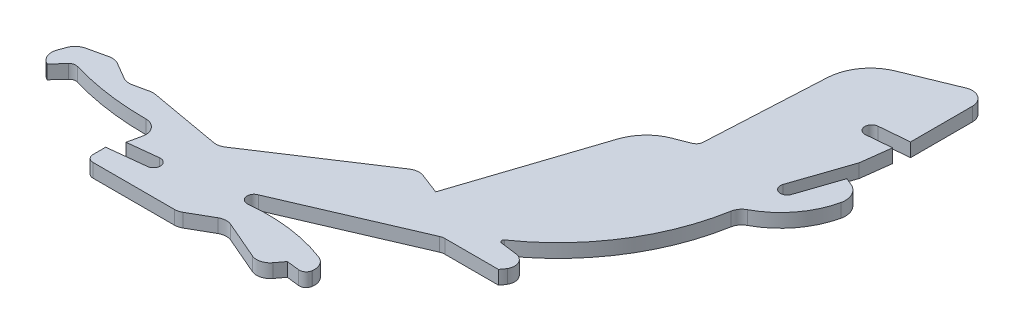
from build123d import *

# Parameters (mm, degrees)
BOSS_EXTRUDE1_DEPTH = 3
FILLET1_R           = 3
FILLET2_R           = 1.5
FILLET3_R           = 10
FILLET4_R           = 3
FILLET5_R           = 4
FILLET6_R           = 2.5
FILLET7_R           = 0.5


with BuildPart() as part:
    # Sketch3 → Boss-Extrude1 (new body)
    with BuildSketch(Plane(origin=(0, 0, 0), x_dir=(1, 0, 0), z_dir=(0, 1, 0))):
        with BuildLine():
            Line((7.923093171, 8.181542538), (1.28839884, 7.442154357))
            Line((1.28839884, 7.442154357), (2.76822933, 14.19))
            ThreePointArc((2.76822933, 14.19), (-8.413807268, 14.494015924), (-19.359710867, 16.8))
            Line((-19.359710867, 16.8), (-22.216794933, 13.666296862))
            Line((-22.216794933, 13.666296862), (-24.820279869, 14.62298821))
            Line((-24.820279869, 14.62298821), (-22.646481841, 20.53863742))
            Line((-22.646481841, 20.53863742), (-15.703804617, 22.111794774))
            Line((-15.703804617, 22.111794774), (-10.073302156, 18.818482014))
            Line((-10.073302156, 18.818482014), (-5.186450964, 19.880840969))
            Line((-5.186450964, 19.880840969), (12.13, 16.8))
            Line((12.13, 16.8), (38.76, 34.29))
            Line((38.76, 34.29), (44.7, 32))
            Line((44.7, 32), (56.058554748, 66.4069852))
            Line((56.058554748, 66.4069852), (64.552315124, 69.756868371))
            Line((64.552315124, 69.756868371), (66.29, 103.00790875))
            Line((66.29, 103.00790875), (87.31, 111.63))
            Line((87.31, 111.63), (87.31, 93.591357519))
            Line((87.31, 93.591357519), (80.722672152, 93.01504101))
            ThreePointArc((80.722672152, 93.01504101), (79.359113719, 91.390015348), (80.984139381, 90.026456915))
            Line((80.984139381, 90.026456915), (86.46321022, 90.505813501))
            Line((86.46321022, 90.505813501), (85.632866314, 84))
            Line((85.632866314, 84), (81.389705108, 71.508585308))
            ThreePointArc((81.389705108, 71.508585308), (82.327545423, 69.605835839), (84.230294892, 70.543676154))
            Line((84.230294892, 70.543676154), (87.31, 79.61))
            Line((87.31, 79.61), (91.618486592, 77.887634392))
            ThreePointArc((91.618486592, 77.887634392), (88.600013238, 68.48894743), (80.984139381, 62.208424889))
            ThreePointArc((80.984139381, 62.208424889), (74.158506271, 43.709858628), (60.297831214, 29.686025056))
            Line((60.297831214, 29.686025056), (68.03871852, 28.66301442))
            ThreePointArc((68.03871852, 28.66301442), (67.586257486, 26.243028794), (66.29, 24.15))
            Line((66.29, 24.15), (54.05, 24.15))
            Line((54.05, 24.15), (25.830040494, 11.99))
            ThreePointArc((25.830040494, 11.99), (24.800734775, 10.253880031), (26.431506195, 9.064692331))
            ThreePointArc((26.431506195, 9.064692331), (36.664028635, 8.803570476), (46.46571567, 5.854056721))
            Line((46.46571567, 5.854056721), (45.9, 1.991540554))
            Line((45.9, 1.991540554), (41.660045255, 2.482673431))
            Line((41.660045255, 2.482673431), (38.9, -1.2))
            Line((38.9, -1.2), (27.015518097, 3.924692331))
            Line((27.015518097, 3.924692331), (20.16, 0))
            Line((20.16, 0), (0, 0))
            Line((0, 0), (0, 4.28))
            Line((0, 4.28), (8.255364291, 5.2))
            ThreePointArc((8.255364291, 5.2), (9.58, 6.856906829), (7.923093171, 8.181542538))
        make_face()
    extrude(amount=BOSS_EXTRUDE1_DEPTH)

    # Fillet1
    # the kernel refuses this fillet: 3 mm, written as the material it adds along each edge
    with BuildSketch(Plane(origin=(80.984139381, 0, -62.208424889), x_dir=(0.9022478681487618, 0, -0.4312177923289046), z_dir=(0, 1, 0))) as fillet1_piece_1:
        with BuildLine():
            CenterArc((1.578679862, -2.997421373), FILLET1_R, 92.37575888, 52.157589609)
            ThreePointArc((-0.864680258, -1.256734347), (-0.427200708, -0.631903288), (0, 0))
            ThreePointArc((0, 0), (0.72716053, -0.015077949), (1.45432106, 0))
        make_face()
    extrude(amount=3)
    with BuildSketch(Plane(origin=(27.015518097, 0, -3.924692331), x_dir=(0.9182659150547935, 0, 0.39596427774305953), z_dir=(0, 1, 0))) as fillet1_piece_2:
        with BuildLine():
            CenterArc((FILLET1_R * 0.49985366711, -FILLET1_R), FILLET1_R, 90, 53.116686758)
            Line((-FILLET1_R * 0.300005823165, -FILLET1_R * 0.399812699386), (0, 0))
            Line((0, 0), (FILLET1_R * 0.49985366711, 0))
        make_face()
    extrude(amount=3)
    with BuildSketch(Plane(origin=(12.13, 0, -16.8), x_dir=(-0.9845393680489544, 0, -0.17516344584919966), z_dir=(0, 1, 0))) as fillet1_piece_3:
        with BuildLine():
            CenterArc((FILLET1_R * 0.397788634748, -FILLET1_R), FILLET1_R, 90, 43.384200988)
            Line((-FILLET1_R * 0.289098500769, -FILLET1_R * 0.273235895863), (0, 0))
            Line((0, 0), (FILLET1_R * 0.397788634748, 0))
        make_face()
    extrude(amount=3)
    with BuildSketch(Plane(origin=(-10.073302156, 0, -18.818482014), x_dir=(-0.863187603129405, 0, -0.5048833150379528), z_dir=(0, 1, 0))) as fillet1_piece_4:
        with BuildLine():
            CenterArc((FILLET1_R * 0.389766900576, -FILLET1_R), FILLET1_R, 90, 42.58838059)
            Line((-FILLET1_R * 0.286959776942, -FILLET1_R * 0.263765659633), (0, 0))
            Line((0, 0), (FILLET1_R * 0.389766900576, 0))
        make_face()
    extrude(amount=3)
    with BuildSketch(Plane(origin=(2.76822933, 0, -14.19), x_dir=(-0.21421340809022724, 0, 0.9767868835085624), z_dir=(0, 1, 0))) as fillet1_piece_5:
        with BuildLine():
            CenterArc((3.855271405, -3), FILLET1_R, 90, 102.505548925)
            ThreePointArc((0.926446282, -3.649602493), (0.490902504, -1.81777488), (0, 0))
            Line((0, 0), (3.855271405, 0))
        make_face()
    extrude(amount=3)
    # the kernel refuses this fillet: 3 mm, written as the material it takes off along each edge
    with BuildSketch(Plane(origin=(-24.820279869, -7.478630688, -14.62298821), x_dir=(0.9386336815677853, 0, 0.3449156590044952), z_dir=(0, 1, 0))) as fillet1_2_piece_1:
        with BuildLine():
            CenterArc((3, 2.991452275), FILLET1_R, 180, 85.673811508)
            Line((0, 2.991452275), (0, 0))
            Line((0, 0), (2.773696477, 0))
        make_face()
    extrude(amount=17.957261376, mode=Mode.SUBTRACT)
    with BuildSketch(Plane(origin=(20.16, -1.994934097, 0), x_dir=(0.8678473261649016, 0, -0.4968309757537575), z_dir=(0, 1, 0))) as fillet1_2_piece_2:
        with BuildLine():
            CenterArc((FILLET1_R * 0.265991212876, FILLET1_R), FILLET1_R, 240.209440415, 29.790559585)
            Line((-FILLET1_R * 0.230839762878, FILLET1_R * 0.132152673835), (0, 0))
            Line((0, 0), (FILLET1_R * 0.265991212876, 0))
        make_face()
    extrude(amount=6.989868193, mode=Mode.SUBTRACT)
    with BuildSketch(Plane(origin=(46.46571567, -6.070952348, -5.854056721), x_dir=(-0.9233291277987619, 0, -0.38400953342121286), z_dir=(0, 1, 0))) as fillet1_2_piece_3:
        with BuildLine():
            CenterArc((2.333722575, 2.99850626), FILLET1_R, 194.249797413, 77.558344276)
            Line((-0.573972765, 2.260056662), (0, 0))
            ThreePointArc((0, 0), (1.21419047, -0.019160317), (2.428380939, 0))
        make_face()
    extrude(amount=15.141904695, mode=Mode.SUBTRACT)
    with BuildSketch(Plane(origin=(38.9, -5.909950036, 1.2), x_dir=(0.5997274231965581, 0, -0.8002043600643629), z_dir=(0, 1, 0))) as fillet1_2_piece_4:
        with BuildLine():
            CenterArc((FILLET1_R * 0.78799333809, FILLET1_R), FILLET1_R, 193.524251091, 76.475748909)
            Line((-FILLET1_R * 0.184277686804, FILLET1_R * 0.766143090435), (0, 0))
            Line((0, 0), (FILLET1_R * 0.78799333809, 0))
        make_face()
    extrude(amount=14.819900071, mode=Mode.SUBTRACT)
    with BuildSketch(Plane(origin=(38.76, -3.852720436, -34.29), x_dir=(-0.8358453893738872, 0, 0.5489649215226915), z_dir=(0, 1, 0))) as fillet1_2_piece_5:
        with BuildLine():
            CenterArc((FILLET1_R * 0.513696058133, FILLET1_R), FILLET1_R, 215.621225969, 54.378774031)
            Line((-FILLET1_R * 0.299188992069, FILLET1_R * 0.417575846005), (0, 0))
            Line((0, 0), (FILLET1_R * 0.513696058133, 0))
        make_face()
    extrude(amount=10.705440872, mode=Mode.SUBTRACT)
    with BuildSketch(Plane(origin=(-5.186450964, -1.481839662, -19.880840969), x_dir=(-0.9771763639228005, 0, 0.2124296443310458), z_dir=(0, 1, 0))) as fillet1_2_piece_6:
        with BuildLine():
            CenterArc((FILLET1_R * 0.197578621542, FILLET1_R), FILLET1_R, 247.647056489, 22.352943511)
            Line((-FILLET1_R * 0.18273230535, FILLET1_R * 0.0751413086926), (0, 0))
            Line((0, 0), (FILLET1_R * 0.197578621542, 0))
        make_face()
    extrude(amount=5.963679323, mode=Mode.SUBTRACT)
    with BuildSketch(Plane(origin=(-15.703804617, -2.961195523, -22.111794774), x_dir=(-0.975276058531981, 0, 0.22099006686800218), z_dir=(0, 1, 0))) as fillet1_2_piece_7:
        with BuildLine():
            CenterArc((FILLET1_R * 0.394826069747, FILLET1_R), FILLET1_R, 226.909202107, 43.090797893)
            Line((-FILLET1_R * 0.288330425897, FILLET1_R * 0.269727994197), (0, 0))
            Line((0, 0), (FILLET1_R * 0.394826069747, 0))
        make_face()
    extrude(amount=8.922391046, mode=Mode.SUBTRACT)
    with BuildSketch(Plane(origin=(-22.646481841, -4.076928403, -20.53863742), x_dir=(-0.3449156590044966, 0, 0.9386336815677849), z_dir=(0, 1, 0))) as fillet1_2_piece_8:
        with BuildLine():
            CenterArc((FILLET1_R * 0.543590453695, FILLET1_R), FILLET1_R, 212.943838396, 57.056161604)
            Line((-FILLET1_R * 0.295613569123, FILLET1_R * 0.456183295506), (0, 0))
            Line((0, 0), (FILLET1_R * 0.543590453695, 0))
        make_face()
    extrude(amount=11.153856805, mode=Mode.SUBTRACT)

    # Fillet2
    fillet2_edges = [part.edges().sort_by_distance(p)[0] for p in [
        (-19.359710867, 1.5, -16.8),
        (64.552315124, 1.5, -69.756868371),
        (45.9, 1.5, -1.991540554),
        (0, 1.5, 0),
    ]]
    fillet(fillet2_edges, radius=FILLET2_R)

    # Fillet3
    fillet3_edges = [part.edges().sort_by_distance(p)[0] for p in [
        (56.058554748, 1.5, -66.4069852),
        (66.29, 1.5, -103.00790875),
    ]]
    fillet(fillet3_edges, radius=FILLET3_R)

    # Fillet4
    fillet4_edges = [part.edges().sort_by_distance(p)[0] for p in [
        (87.31, 1.5, -111.63),
    ]]
    fillet(fillet4_edges, radius=FILLET4_R)

    # Fillet5
    fillet5_edges = [part.edges().sort_by_distance(p)[0] for p in [
        (91.618486592, 1.5, -77.887634392),
    ]]
    fillet(fillet5_edges, radius=FILLET5_R)

    # Fillet6
    fillet6_edges = [part.edges().sort_by_distance(p)[0] for p in [
        (68.03871852, 1.5, -28.66301442),
        (54.05, 1.5, -24.15),
    ]]
    fillet(fillet6_edges, radius=FILLET6_R)

    # Fillet7
    fillet7_edges = [part.edges().sort_by_distance(p)[0] for p in [
        (60.297831214, 1.5, -29.686025056),
    ]]
    fillet(fillet7_edges, radius=FILLET7_R)


solid = part.part
